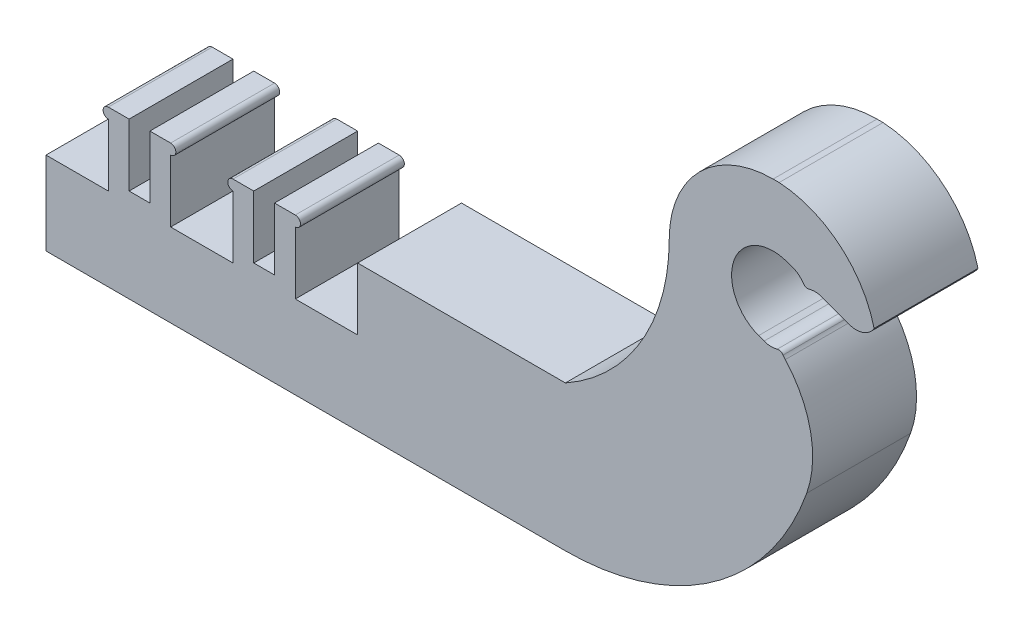
from build123d import *

# Parameters (mm, degrees)
BOSS_EXTRUDE1_DEPTH = 5
BOSS_EXTRUDE2_DEPTH = 5
SKETCH4_W           = 3
SKETCH4_H           = 4
BOSS_EXTRUDE3_DEPTH = 5
SKETCH5_W           = 1
SKETCH5_H           = 3
CUT_EXTRUDE4_DEPTH  = 5
FILLET1_R           = 1
FILLET2_R           = 5


with BuildPart() as part:
    # Sketch1 → Boss-Extrude1 (new body)
    with BuildSketch(Plane.XY):
        with BuildLine():
            Line((-20, -8.5), (-20, -11.5))
            Line((-20, -11.5), (-23, -11.5))
            Line((-23, -11.5), (-23, -8.5))
            Line((-23, -8.5), (-26, -8.5))
            Line((-26, -8.5), (-26, -11.5))
            Line((-26, -11.5), (-29, -11.5))
            Line((-29, -11.5), (-29, -8.5))
            Line((-29, -8.5), (-32, -8.5))
            Line((-32, -8.5), (-32, -11.5))
            Line((-32, -11.5), (-32, -15.5))
            Line((-32, -15.5), (-18.491569603, -15.5))
            Line((-18.491569603, -15.5), (-10, -15.5))
            ThreePointArc((-10, -15.5), (-1.223745781, -11.827646194), (2.321718109, -2.999367403))
            Line((2.321718109, -2.999367403), (-0.6982883, -1.874138055))
            ThreePointArc((-0.6982883, -1.874138055), (-1.874138055, 0.6982883), (0.6982883, 1.874138055))
            Line((0.6982883, 1.874138055), (3.65085585, 0.774035867))
            ThreePointArc((3.65085585, 0.774035867), (4.334374397, 0.768664571), (4.86166438, 1.203626327))
            ThreePointArc((4.86166438, 1.203626327), (3.199966458, 3.852883536), (0.290683459, 5))
            Line((0.290683459, 5), (0, 5))
            ThreePointArc((0, 5), (-3.535533906, 3.535533906), (-5, 0))
            ThreePointArc((-5, 0), (-6.342689758, -4.930770731), (-10, -8.5))
            Line((-10, -8.5), (-20, -8.5))
        make_face()
    extrude(amount=BOSS_EXTRUDE1_DEPTH)

    # Sketch2 → Boss-Extrude2 (add)
    with BuildSketch(Plane.XY.offset(5)):
        with BuildLine():
            Line((1.429929688, 1.60153454), (1.898464202, 1.426962465))
            ThreePointArc((1.898464202, 1.426962465), (1.576910907, 1.279981246), (1.429929688, 1.60153454))
        make_face()
        with BuildLine():
            Line((0.501887602, -2.321313645), (0.033353088, -2.14674157))
            ThreePointArc((0.033353088, -2.14674157), (0.354906382, -1.999760351), (0.501887602, -2.321313645))
        make_face()
    extrude(amount=-BOSS_EXTRUDE2_DEPTH)

    # Sketch4 → Boss-Extrude3 (add)
    with BuildSketch(Plane.XY.offset(5)):
        with Locations((-33.5, -13.5)):
            Rectangle(SKETCH4_W, SKETCH4_H)
        with BuildLine():
            Line((-32, -8.5), (-29, -8.5))
            ThreePointArc((-29, -8.5), (-28.75, -8.25), (-29, -8))
            Line((-29, -8), (-32, -8))
            ThreePointArc((-32, -8), (-32.25, -8.25), (-32, -8.5))
        make_face()
        with BuildLine():
            Line((-26, -8.5), (-23, -8.5))
            ThreePointArc((-23, -8.5), (-22.75, -8.25), (-23, -8))
            Line((-23, -8), (-26, -8))
            ThreePointArc((-26, -8), (-26.25, -8.25), (-26, -8.5))
        make_face()
    extrude(amount=-BOSS_EXTRUDE3_DEPTH)

    # Sketch5 → Cut-Extrude4 (cut)
    with BuildSketch(Plane.XY.offset(5)):
        with Locations((-30.5, -9.5)):
            Rectangle(SKETCH5_W, SKETCH5_H)
        with Locations((-24.5, -9.5)):
            Rectangle(SKETCH5_W, SKETCH5_H)
    extrude(amount=-CUT_EXTRUDE4_DEPTH, mode=Mode.SUBTRACT)

    # Fillet1
    fillet1_edges = [part.edges().sort_by_distance(p)[0] for p in [
        (1.429929688, 1.60153454, 2.5),
        (1.898464202, 1.426962465, 2.5),
        (0.501887602, -2.321313645, 2.5),
        (0.033353088, -2.14674157, 2.5),
    ]]
    fillet(fillet1_edges, radius=FILLET1_R)

    # Fillet2
    fillet2_edges = [part.edges().sort_by_distance(p)[0] for p in [
        (2.321718109, -2.999367403, 2.5),
    ]]
    fillet(fillet2_edges, radius=FILLET2_R)


solid = part.part
